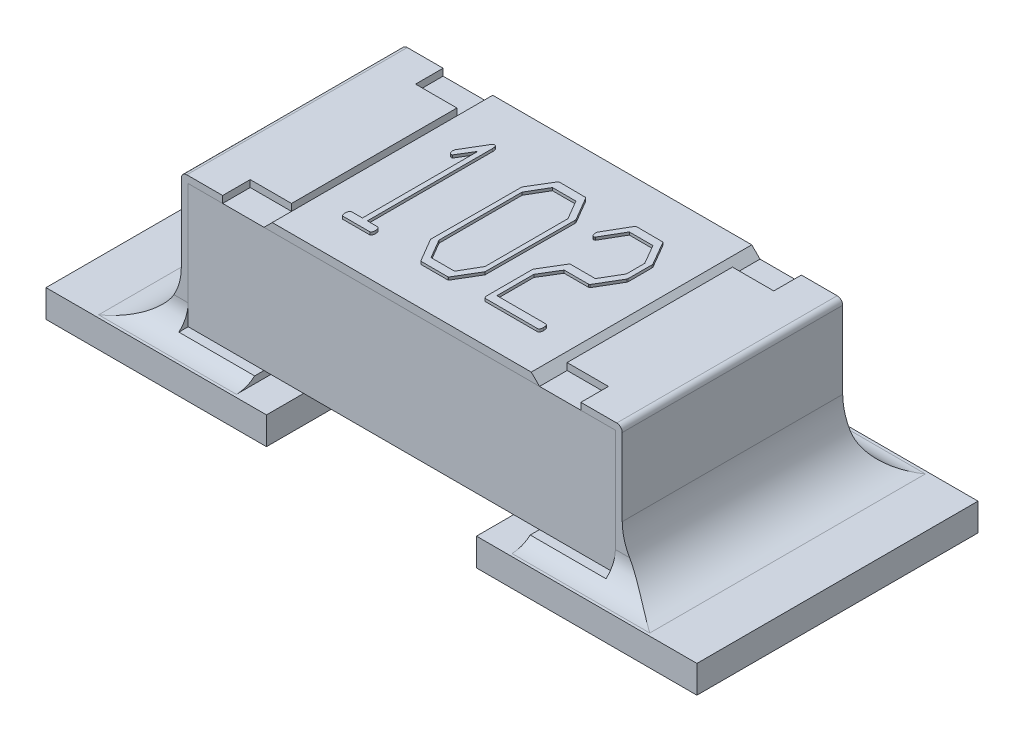
from build123d import *

# Parameters (mm, degrees)
SKETCH1_W             = 0.8
SKETCH1_H             = 0.45
BOSS_EXTRUDE1_DEPTH   = 0.775
BOSS_EXTRUDE2_DEPTH   = 0.4
BOSS_EXTRUDE2_2_DEPTH = 0.4
SKETCH3_W             = 0.15
SKETCH3_H             = 0.1
CUT_EXTRUDE1_DEPTH    = 0.025
BOSS_EXTRUDE3_DEPTH   = 0.4
BOSS_EXTRUDE4_DEPTH   = 0.01
SKETCH7_W             = 0.8
SKETCH7_H             = 1.02
BOSS_EXTRUDE5_DEPTH   = 0.1
FILLET3_R             = 0.2
FILLET4_R             = 0.2
FILLET5_R             = 0.1
FILLET6_R             = 0.1


with BuildPart() as part:
    # Sketch1 → Boss-Extrude1 (new, symmetric)
    with BuildSketch(Plane(origin=(0, 0, 0), x_dir=(0, 0, -1), z_dir=(1, 0, 0))):
        with Locations((0, 0.35)):
            Rectangle(SKETCH1_W, SKETCH1_H)
    extrude(amount=BOSS_EXTRUDE1_DEPTH, both=True)


with BuildPart() as body_2:
    # Sketch2 → Boss-Extrude2 (new, symmetric)
    with BuildSketch(Plane.XY):
        with BuildLine():
            Line((-0.5, 0.6), (-0.78, 0.6))
            ThreePointArc((-0.78, 0.6), (-0.794142136, 0.594142136), (-0.8, 0.58))
            Line((-0.8, 0.58), (-0.8, 0.1))
            Line((-0.8, 0.1), (-0.5, 0.1))
            Line((-0.5, 0.1), (-0.5, 0.125))
            Line((-0.5, 0.125), (-0.775, 0.125))
            Line((-0.775, 0.125), (-0.775, 0.575))
            Line((-0.775, 0.575), (-0.5, 0.575))
            Line((-0.5, 0.575), (-0.5, 0.6))
        make_face()
    extrude(amount=BOSS_EXTRUDE2_DEPTH, both=True)


with BuildPart() as body_3:
    # Sketch2 → Boss-Extrude2 2 (new, symmetric)
    with BuildSketch(Plane.XY):
        with BuildLine():
            Line((0.5, 0.575), (0.5, 0.6))
            Line((0.5, 0.6), (0.78, 0.6))
            ThreePointArc((0.78, 0.6), (0.794142136, 0.594142136), (0.8, 0.58))
            Line((0.8, 0.58), (0.8, 0.1))
            Line((0.8, 0.1), (0.5, 0.1))
            Line((0.5, 0.1), (0.5, 0.125))
            Line((0.5, 0.125), (0.775, 0.125))
            Line((0.775, 0.125), (0.775, 0.575))
            Line((0.775, 0.575), (0.5, 0.575))
        make_face()
    extrude(amount=BOSS_EXTRUDE2_2_DEPTH, both=True)


with BuildPart() as cut_extrude1_tool:
    # Sketch3 → Cut-Extrude1 (new body)
    with BuildSketch(Plane(origin=(0, 0.6, 0), x_dir=(1, 0, 0), z_dir=(0, 1, 0))):
        with Locations((-0.575, 0.35)):
            Rectangle(SKETCH3_W, SKETCH3_H)
        with Locations((-0.575, -0.35)):
            Rectangle(SKETCH3_W, SKETCH3_H)
        with Locations((0.575, -0.35)):
            Rectangle(SKETCH3_W, SKETCH3_H)
        with Locations((0.575, 0.35)):
            Rectangle(SKETCH3_W, SKETCH3_H)
    extrude(amount=-CUT_EXTRUDE1_DEPTH)


with BuildPart() as body_2_1:
    add(body_2.part)

    # Cut-Extrude1: cut by cut_extrude1_tool
    add(cut_extrude1_tool.part, mode=Mode.SUBTRACT)



with BuildPart() as body_3_1:
    add(body_3.part)

    # Cut-Extrude1: cut by cut_extrude1_tool
    add(cut_extrude1_tool.part, mode=Mode.SUBTRACT)


with BuildPart() as body_4:
    # Sketch4 → Boss-Extrude3 (new, symmetric)
    with BuildSketch(Plane.XY):
        Polygon((-0.5, 0.575), (0.5, 0.575), (0.47, 0.605), (-0.47, 0.605), align=None)
    extrude(amount=BOSS_EXTRUDE3_DEPTH, both=True)

    # Sketch6 → Boss-Extrude4 (add)
    # profile 1 of 3: a face of its own
    with BuildSketch(Plane(origin=(0, 0.605, 0), x_dir=(1, 0, 0), z_dir=(0, 1, 0))):
        with BuildLine():
            Line((-0.292857143, 0.221819196), (-0.292857143, -0.232142857))
            Line((-0.292857143, -0.232142857), (-0.253608631, -0.232142857))
            add(Edge.make_bspline(
                [(-0.253608631, -0.232142857), (-0.252514915, -0.233159523), (-0.250346122, -0.235175528), (-0.248921239, -0.239323698), (-0.247952001, -0.243100354), (-0.24781151, -0.245561302), (-0.247749256, -0.246651786)],
                knots=[0, 0, 0, 0, 1.094507773, 2.170363376, 3.18925981, 4, 4, 4, 4], degree=3))
            add(Edge.make_bspline(
                [(-0.247749256, -0.246651786), (-0.247790011, -0.24890061), (-0.247860511, -0.252790757), (-0.248927629, -0.257670974), (-0.250957131, -0.261266063), (-0.253164339, -0.261705298), (-0.254166667, -0.261904762)],
                knots=[0, 0, 0, 0, 1.483935822, 2.566997854, 3.349251094, 4, 4, 4, 4], degree=3))
            Line((-0.254166667, -0.261904762), (-0.352287946, -0.261904762))
            add(Edge.make_bspline(
                [(-0.352287946, -0.261904762), (-0.353191845, -0.261383497), (-0.355138277, -0.260261018), (-0.356845026, -0.256793507), (-0.357784968, -0.252323852), (-0.357898096, -0.248923727), (-0.35796131, -0.24702381)],
                knots=[0, 0, 0, 0, 0.731657516, 1.575533429, 2.645259425, 4, 4, 4, 4], degree=3))
            add(Edge.make_bspline(
                [(-0.35796131, -0.24702381), (-0.357847061, -0.245999991), (-0.357543408, -0.24327885), (-0.356855684, -0.239634421), (-0.355750939, -0.236384481), (-0.354715358, -0.234196716), (-0.35312544, -0.232808963), (-0.351931893, -0.232359173), (-0.351357887, -0.232142857)],
                knots=[0, 0, 0, 0, 1.077846596, 2.864738214, 3.859388994, 4.671949365, 5.361307703, 6, 6, 6, 6], degree=3))
            Line((-0.351357887, -0.232142857), (-0.310714286, -0.232142857))
            Line((-0.310714286, -0.232142857), (-0.310714286, 0.186476935))
            Line((-0.310714286, 0.186476935), (-0.345219494, 0.130208333))
            add(Edge.make_bspline(
                [(-0.345219494, 0.130208333), (-0.34594703, 0.129816395), (-0.34723663, 0.129121662), (-0.348681862, 0.128906863), (-0.349311756, 0.128813244)],
                knots=[0, 0, 0, 0, 1.128313794, 2, 2, 2, 2], degree=3))
            add(Edge.make_bspline(
                [(-0.349311756, 0.128813244), (-0.34994165, 0.128906863), (-0.351386882, 0.129121662), (-0.352676481, 0.129816395), (-0.353404018, 0.130208333)],
                knots=[0, 0, 0, 0, 0.871686206, 2, 2, 2, 2], degree=3))
            add(Edge.make_bspline(
                [(-0.353404018, 0.130208333), (-0.354762035, 0.132029405), (-0.357658077, 0.135912935), (-0.35809911, 0.140752164), (-0.358333333, 0.143322173)],
                knots=[0, 0, 0, 0, 0.937843913, 2, 2, 2, 2], degree=3))
            Line((-0.358333333, 0.143322173), (-0.357124256, 0.150297619))
            Line((-0.357124256, 0.150297619), (-0.306901042, 0.234654018))
            add(Edge.make_bspline(
                [(-0.306901042, 0.234654018), (-0.306052725, 0.23565958), (-0.304616067, 0.23736254), (-0.302476074, 0.237882361), (-0.301599702, 0.238095238)],
                knots=[0, 0, 0, 0, 1.180958283, 2, 2, 2, 2], degree=3))
            add(Edge.make_bspline(
                [(-0.301599702, 0.238095238), (-0.300254548, 0.237901979), (-0.297496165, 0.23750568), (-0.29448599, 0.233775342), (-0.293094631, 0.228376002), (-0.292944039, 0.224218313), (-0.292857143, 0.221819196)],
                knots=[0, 0, 0, 0, 0.76869288, 1.576286457, 2.601441333, 4, 4, 4, 4], degree=3))
        make_face()
    # profile 2 of 3: a face of its own
    with BuildSketch(Plane(origin=(0, 0.605, 0), x_dir=(1, 0, 0), z_dir=(0, 1, 0))):
        Polygon((0.032849702, 0.234002976), (0.081305804, 0.151227679), (0.082142857, 0.145182292), (0.080561756, -0.178478423), (0.031268601, -0.26125372), (0.027269345, -0.261904762), (-0.068526786, -0.261904762), (-0.07094494, -0.259207589), (-0.119866071, -0.17578125), (-0.120238095, -0.168991815), (-0.118656994, 0.154668899), (-0.069363839, 0.236700149), (-0.066945685, 0.238095238), (0.030059524, 0.237444196), align=None)
        Polygon((0.064285714, 0.138764881), (0.023549107, 0.208333333), (-0.061644345, 0.208333333), (-0.102380952, 0.138764881), (-0.102380952, -0.162574405), (-0.061644345, -0.232142857), (0.023549107, -0.232142857), (0.064285714, -0.161923363), align=None, mode=Mode.SUBTRACT)
    # profile 3 of 3: a face of its own
    with BuildSketch(Plane(origin=(0, 0.605, 0), x_dir=(1, 0, 0), z_dir=(0, 1, 0))):
        with BuildLine():
            Line((0.312611607, 0.234002976), (0.361067708, 0.150204613))
            Line((0.361067708, 0.150204613), (0.361904762, 0.143973214))
            Line((0.361904762, 0.143973214), (0.361904762, 0.060918899))
            Line((0.361904762, 0.060918899), (0.361067708, 0.056082589))
            Line((0.361067708, 0.056082589), (0.311588542, -0.027715774))
            Line((0.311588542, -0.027715774), (0.30796131, -0.029761905))
            Line((0.30796131, -0.029761905), (0.218954613, -0.029761905))
            Line((0.218954613, -0.029761905), (0.177380952, -0.09812128))
            Line((0.177380952, -0.09812128), (0.177380952, -0.232142857))
            Line((0.177380952, -0.232142857), (0.355487351, -0.232142857))
            add(Edge.make_bspline(
                [(0.355487351, -0.232142857), (0.356480886, -0.232556276), (0.358585225, -0.233431911), (0.360715329, -0.236818481), (0.361759099, -0.241464864), (0.361852564, -0.245031762), (0.361904762, -0.24702381)],
                knots=[0, 0, 0, 0, 0.727922013, 1.541763566, 2.627120282, 4, 4, 4, 4], degree=3))
            add(Edge.make_bspline(
                [(0.361904762, -0.24702381), (0.36186162, -0.248986973), (0.361781674, -0.252624852), (0.360690533, -0.256848985), (0.359352013, -0.259656481), (0.357641711, -0.261012244), (0.355482829, -0.26175373), (0.353912619, -0.261851985), (0.353069196, -0.261904762)],
                knots=[0, 0, 0, 0, 1.783226064, 3.304443306, 3.949222629, 4.571326795, 5.232602427, 6, 6, 6, 6], degree=3))
            Line((0.353069196, -0.261904762), (0.164732143, -0.261904762))
            add(Edge.make_bspline(
                [(0.164732143, -0.261904762), (0.163525948, -0.260801207), (0.160923376, -0.2584201), (0.160012519, -0.254998187), (0.15952381, -0.253162202)],
                knots=[0, 0, 0, 0, 0.926925341, 2, 2, 2, 2], degree=3))
            Line((0.15952381, -0.253162202), (0.15952381, -0.239676339))
            Line((0.15952381, -0.239676339), (0.15952381, -0.083519345))
            Line((0.15952381, -0.083519345), (0.209188988, -0.001302083))
            Line((0.209188988, -0.001302083), (0.211514137, 0))
            Line((0.211514137, 0), (0.302380952, 0))
            Line((0.302380952, 0), (0.344047619, 0.07077753))
            Line((0.344047619, 0.07077753), (0.344047619, 0.137555804))
            Line((0.344047619, 0.137555804), (0.303031994, 0.208333333))
            Line((0.303031994, 0.208333333), (0.217280506, 0.208333333))
            Line((0.217280506, 0.208333333), (0.171893601, 0.130208333))
            add(Edge.make_bspline(
                [(0.171893601, 0.130208333), (0.171165939, 0.129817639), (0.169903116, 0.129139609), (0.168492246, 0.128910385), (0.167894345, 0.128813244)],
                knots=[0, 0, 0, 0, 1.152437574, 2, 2, 2, 2], degree=3))
            add(Edge.make_bspline(
                [(0.167894345, 0.128813244), (0.166715898, 0.129002619), (0.16419856, 0.129407153), (0.161400816, 0.132865271), (0.159681434, 0.137855724), (0.159581059, 0.14181055), (0.15952381, 0.14406622)],
                knots=[0, 0, 0, 0, 0.723786097, 1.5461138, 2.600403721, 4, 4, 4, 4], degree=3))
            Line((0.15952381, 0.14406622), (0.160360863, 0.150297619))
            Line((0.160360863, 0.150297619), (0.209654018, 0.23530506))
            Line((0.209654018, 0.23530506), (0.21281622, 0.238095238))
            Line((0.21281622, 0.238095238), (0.309821429, 0.237444196))
            Line((0.309821429, 0.237444196), (0.312611607, 0.234002976))
        make_face()
    extrude(amount=BOSS_EXTRUDE4_DEPTH)


with BuildPart() as body_2_2:
    add(body_2_1.part)

    add(body_3_1.part)  # Boss-Extrude5 merges body 3
    # Sketch7 → Boss-Extrude5 (add)
    with BuildSketch(Plane(origin=(0, 0, 0), x_dir=(1, 0, 0), z_dir=(0, 1, 0))):
        with Locations((-0.781, 0)):
            Rectangle(SKETCH7_W, SKETCH7_H)
        with Locations((0.781, 0)):
            Rectangle(SKETCH7_W, SKETCH7_H)
    extrude(amount=BOSS_EXTRUDE5_DEPTH)

    # Fillet3
    fillet3_edges = [body_2_2.edges().sort_by_distance(p)[0] for p in [
        (-0.8, 0.1, 0),
    ]]
    fillet(fillet3_edges, radius=FILLET3_R)

    # Fillet4
    fillet4_edges = [body_2_2.edges().sort_by_distance(p)[0] for p in [
        (0.8, 0.1, 0),
    ]]
    fillet(fillet4_edges, radius=FILLET4_R)

    # Fillet5
    fillet5_edges = [body_2_2.edges().sort_by_distance(p)[0] for p in [
        (0.75, 0.1, 0.4),
    ]]
    fillet(fillet5_edges, radius=FILLET5_R)
    fillet5_2_edges = [body_2_2.edges().sort_by_distance(p)[0] for p in [
        (0.75, 0.1, -0.4),
    ]]
    fillet(fillet5_2_edges, radius=FILLET5_R)

    # Fillet6
    fillet6_edges = [body_2_2.edges().sort_by_distance(p)[0] for p in [
        (-0.75, 0.1, -0.4),
    ]]
    fillet(fillet6_edges, radius=FILLET6_R)
    fillet6_2_edges = [body_2_2.edges().sort_by_distance(p)[0] for p in [
        (-0.75, 0.1, 0.4),
    ]]
    fillet(fillet6_2_edges, radius=FILLET6_R)


solid = Compound([part.part, body_4.part, body_2_2.part])
